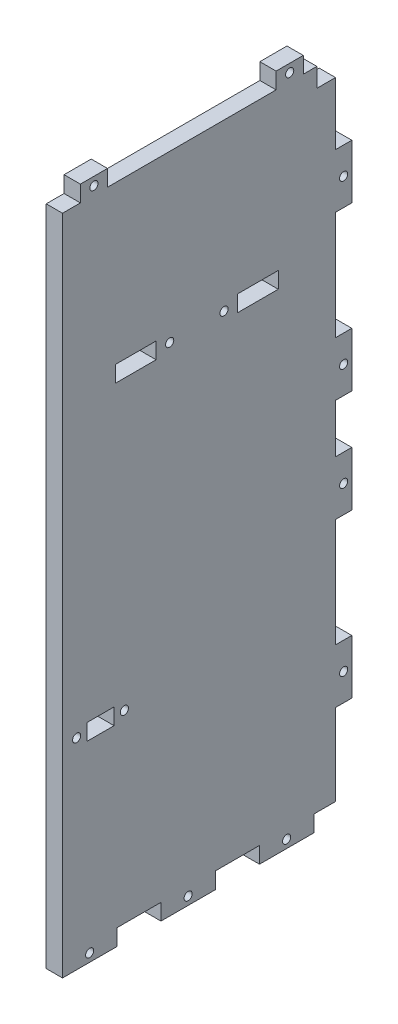
from build123d import *

# Parameters (mm, degrees)
ESQUISSE1_W             = 100.58
ESQUISSE1_H             = 238
ESQUISSE1_W_2           = 10
ESQUISSE1_H_2           = 6
ESQUISSE1_W_3           = 15
BOSS_EXTRU_1_DEPTH      = 6
ESQUISSE3_W             = 20
ESQUISSE3_H             = 6
ESQUISSE3_W_2           = 6
ESQUISSE3_H_2           = 20
ESQUISSE3_W_3           = 10
BOSS_EXTRU_5_DEPTH      = 6
ESQUISSE7_W             = 6.88
ESQUISSE7_H             = 7
ENL_V_MAT_EXTRU_3_DEPTH = 6
ESQUISSE8_R             = 1.5
ENL_V_MAT_EXTRU_4_DEPTH = 6


with BuildPart() as part:
    # Esquisse1 → Boss.-Extru.1 (new body)
    with BuildSketch(Plane(origin=(0, 0, 0), x_dir=(0, 0, -1), z_dir=(1, 0, 0))):
        Rectangle(ESQUISSE1_W, ESQUISSE1_H)
        with Locations((-36.29, -51)):
            Rectangle(ESQUISSE1_W_2, ESQUISSE1_H_2, mode=Mode.SUBTRACT)
        with Locations((-23.295, 58)):
            Rectangle(ESQUISSE1_W_3, ESQUISSE1_H_2, mode=Mode.SUBTRACT)
        with Locations((21.705, 58)):
            Rectangle(ESQUISSE1_W_3, ESQUISSE1_H_2, mode=Mode.SUBTRACT)
    extrude(amount=BOSS_EXTRU_1_DEPTH)

    # Esquisse3 → Boss.-Extru.5 (add)
    with BuildSketch(Plane(origin=(6, 0, 0), x_dir=(0, 0, -1), z_dir=(1, 0, 0))):
        with Locations((-40.29, -122)):
            Rectangle(ESQUISSE3_W, ESQUISSE3_H)
        with Locations((32.29, -122)):
            Rectangle(ESQUISSE3_W, ESQUISSE3_H)
        with Locations((53.29, 19)):
            Rectangle(ESQUISSE3_W_2, ESQUISSE3_H_2)
        with Locations((53.29, 79)):
            Rectangle(ESQUISSE3_W_2, ESQUISSE3_H_2)
        with Locations((53.29, -79)):
            Rectangle(ESQUISSE3_W_2, ESQUISSE3_H_2)
        with Locations((53.29, -19)):
            Rectangle(ESQUISSE3_W_2, ESQUISSE3_H_2)
        with Locations((-4, -122)):
            Rectangle(ESQUISSE3_W, ESQUISSE3_H)
        with Locations((33.41, 122)):
            Rectangle(ESQUISSE3_W_3, ESQUISSE3_H)
        with Locations((-38.71, 122)):
            Rectangle(ESQUISSE3_W_3, ESQUISSE3_H)
    extrude(amount=-BOSS_EXTRU_5_DEPTH)

    # Esquisse7 → Enlèv. mat.-Extru.3 (cut)
    with BuildSketch(Plane.ZY):
        with Locations((-46.85, 115.5)):
            Rectangle(ESQUISSE7_W, ESQUISSE7_H)
    extrude(amount=-ENL_V_MAT_EXTRU_3_DEPTH, mode=Mode.SUBTRACT)

    # Esquisse8 → Enlèv. mat.-Extru.4 (cut)
    with BuildSketch(Plane.ZY):
        with Locations((4, -122)):
            Circle(ESQUISSE8_R)
        with Locations((-9.205, 58)):
            Circle(ESQUISSE8_R)
        with Locations((10.795, 58)):
            Circle(ESQUISSE8_R)
        with Locations((27.5, -51)):
            Circle(ESQUISSE8_R)
        with Locations((45.08, -51)):
            Circle(ESQUISSE8_R)
        with Locations((38.71, 122)):
            Circle(ESQUISSE8_R)
        with Locations((-33.41, 122)):
            Circle(ESQUISSE8_R)
        with Locations((40.29, -122)):
            Circle(ESQUISSE8_R)
        with Locations((-53.29, 79)):
            Circle(ESQUISSE8_R)
        with Locations((-32.29, -122)):
            Circle(ESQUISSE8_R)
        with Locations((-53.29, 19)):
            Circle(ESQUISSE8_R)
        with Locations((-53.29, -79)):
            Circle(ESQUISSE8_R)
        with Locations((-53.29, -19)):
            Circle(ESQUISSE8_R)
    extrude(amount=-ENL_V_MAT_EXTRU_4_DEPTH, mode=Mode.SUBTRACT)


solid = part.part
